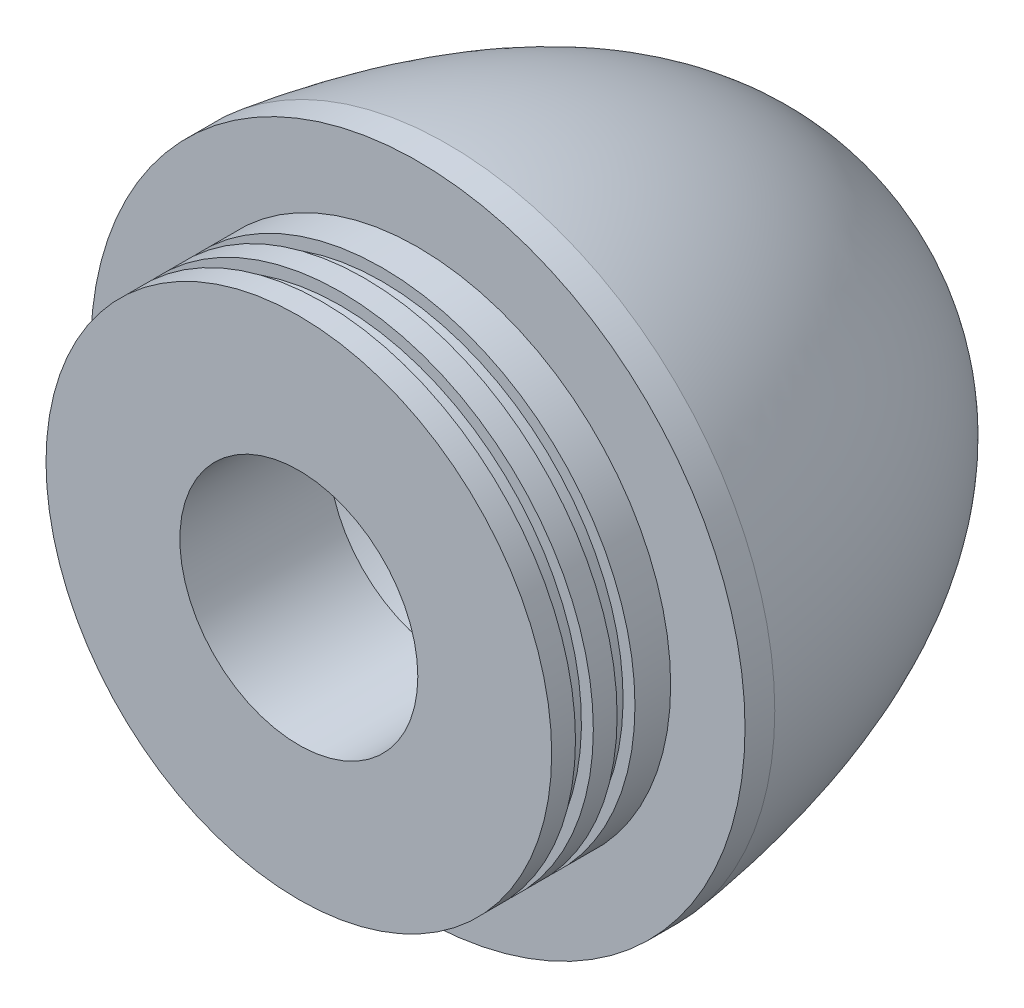
from build123d import *

# Parameters (mm, degrees)
SKETCH1_R           = 55
BOSS_EXTRUDE1_DEPTH = 5
SKETCH2_R           = 42.5
BOSS_EXTRUDE2_DEPTH = 20
SKETCH4_W           = 3
SKETCH4_H           = 2
SKETCH6_R           = 20
CUT_EXTRUDE1_DEPTH  = 82.700673192


with BuildPart() as part:
    # Sketch1 → Boss-Extrude1 (new body)
    with BuildSketch(Plane.XY):
        Circle(SKETCH1_R)
    extrude(amount=BOSS_EXTRUDE1_DEPTH)

    # Sketch2 → Boss-Extrude2 (add)
    with BuildSketch(Plane.XY.offset(5)):
        Circle(SKETCH2_R)
    extrude(amount=BOSS_EXTRUDE2_DEPTH)

    # Sketch4 → Cut-Revolve1 (revolve, cut)
    with BuildSketch(Plane(origin=(0, 0, 0), x_dir=(0, 0, -1), z_dir=(1, 0, 0))):
        with Locations((-12.5, 41.5)):
            Rectangle(SKETCH4_W, SKETCH4_H)
        with Locations((-19.5, 41.5)):
            Rectangle(SKETCH4_W, SKETCH4_H)
    revolve(axis=Axis((0, 0, 0), (0, 0, 1)), mode=Mode.SUBTRACT)

    # Sketch6 → Cut-Extrude1 (cut, through all)
    with BuildSketch(Plane.XY.offset(25)):
        Circle(SKETCH6_R)
    extrude(amount=-CUT_EXTRUDE1_DEPTH, mode=Mode.SUBTRACT)

    # Sketch5 → Revolve2 (revolve)
    with BuildSketch(Plane(origin=(0, 0, 0), x_dir=(0, 0, -1), z_dir=(1, 0, 0))):
        with BuildLine():
            add(Edge.make_bspline(
                [(70, 0), (70, -39.5), (28.256178549, -51.280003522), (0, -55)],
                knots=[0, 0, 0, 0, 1, 1, 1, 1], degree=3))
            Line((70, 0), (65, 0))
            add(Edge.make_bspline(
                [(65, 0), (65, -0.554864633), (64.981436241, -1.674915295), (64.872220837, -3.83061817), (64.604539276, -6.4277928), (64.085621474, -9.378566722), (63.144730223, -13.110590324), (61.526765788, -17.417442381), (58.940406539, -22.087849163), (55.755312842, -26.319118313), (50.769938939, -31.425777046), (43.277283374, -36.861745144), (32.80907241, -41.96762184), (23.396767568, -45.137900765), (15.792202046, -47.105869741), (10.133895038, -48.321896833), (5.533398697, -49.138353879), (2.230014163, -49.645161929), (0.704001374, -49.860244928), (0.054577985, -49.948325704), (0, -49.955703956)],
                knots=[0, 0, 0, 0, 0.015625, 0.03125, 0.0625, 0.09375, 0.125, 0.1875, 0.25, 0.3125, 0.375, 0.5, 0.625, 0.75, 0.8125, 0.875, 0.9375, 0.96875, 0.990159048, 0.992127238, 0.992127238, 0.992127238, 0.992127238], degree=3))
            Line((0, -49.955703956), (0, -55))
        make_face()
    revolve(axis=Axis((0, 0, 0), (0, 0, -1)))


solid = part.part
